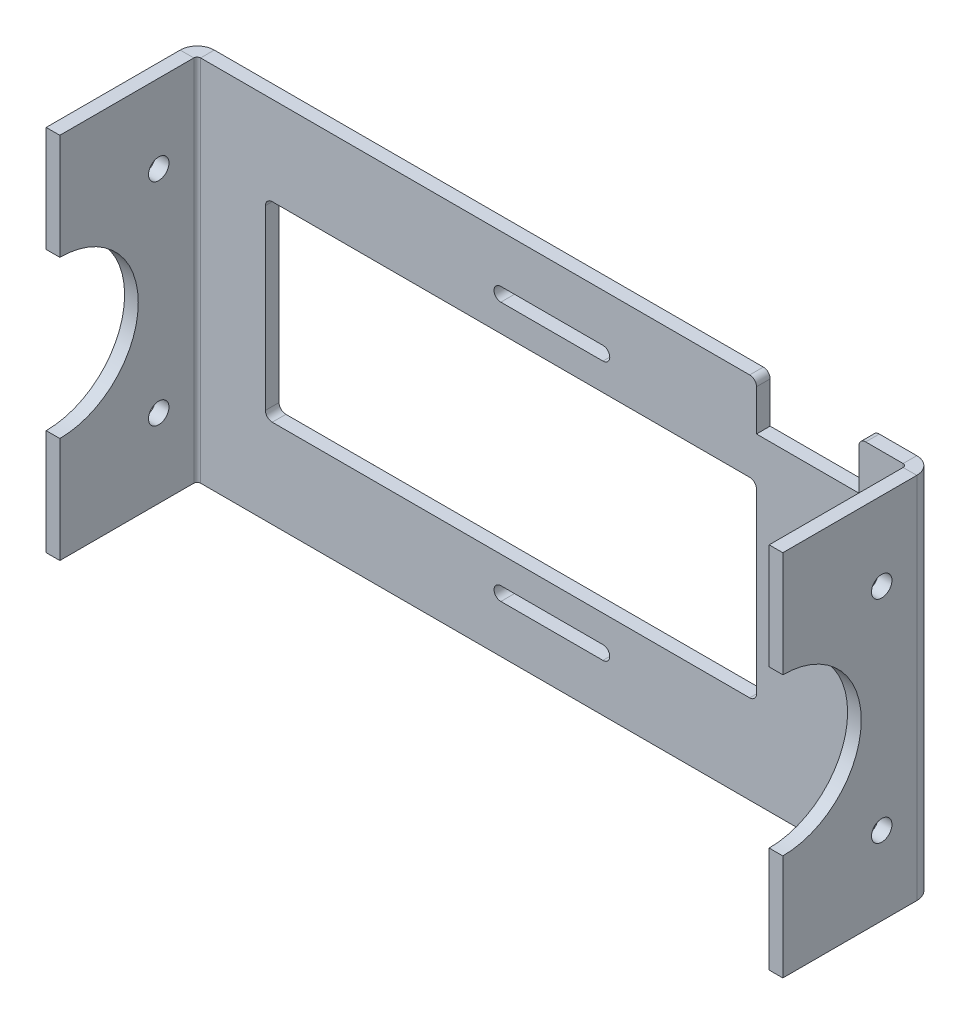
from build123d import *
from build123d.topology import SkipClean

# Parameters (mm, degrees)
DODANIE_WYCI_GNI_CIE1_DEPTH = 2
SZKIC_START                 = -28.065385
SZKIC_ZGI_CIA1_DEPTH        = 54
SZKIC_ZGI_CIA1_2_DEPTH      = 15.5
SZKIC_START_2               = 10.434615
SZKIC_ZGI_CIA1_3_DEPTH      = 15.5
SZKIC_START_3               = -56.031828
SZKIC_ZGI_CIA1_4_DEPTH      = 2.423909
SZKIC_START_4               = -12.565385
SZKIC_ZGI_CIA1_5_DEPTH      = 23
SZKIC_ZGI_CIA1_6_DEPTH      = 23
SZKIC_ZGI_CIA2_DEPTH        = 54
SZKIC_ZGI_CIA2_2_DEPTH      = 54
SZKIC_START_5               = 49.968172
SZKIC_ZGI_CIA2_3_DEPTH      = 2
SZKIC9_W                    = 72
SZKIC9_H                    = 28
SZKIC9_W_2                  = 15
SZKIC9_H_2                  = 7
WYTNIJ_WYCI_GNI_CIE1_DEPTH  = 66.825561
SZKIC10_R                   = 1.5
WYTNIJ_WYCI_GNI_CIE2_DEPTH  = 114.762973
ZAOKR_GLENIE2_R             = 1
ZAOKR_GLENIE3_R             = 1


with BuildPart() as part:
    # Szkic1 → Dodanie-wyciągnięcie1 (new body)
    with BuildSketch(Plane.XY):
        with BuildLine():
            Line((-75.531828, 25.934615), (71.468172, 25.934615))
            Line((71.468172, 25.934615), (71.468172, 10.434615))
            ThreePointArc((71.468172, 10.434615), (59.968172, -1.065385), (71.468172, -12.565385))
            Line((71.468172, -12.565385), (71.468172, -28.065385))
            Line((71.468172, -28.065385), (-75.531828, -28.065385))
            Line((-75.531828, -28.065385), (-75.531828, -12.565385))
            ThreePointArc((-75.531828, -12.565385), (-64.031828, -1.065385), (-75.531828, 10.434615))
            Line((-75.531828, 10.434615), (-75.531828, 25.934615))
        make_face()
    extrude(amount=DODANIE_WYCI_GNI_CIE1_DEPTH)

    # Szkic zgięcia1: read off the stored shape, not the designer's step
    # Szkic zgięcia1 outline → Szkic zgięcia1 (cut)
    with BuildSketch(Plane(origin=(0, 0, 0), x_dir=(1, 0, 0), z_dir=(0, 1, 0)).offset(SZKIC_START)):
        with BuildLine():
            Line((-75.531828, -2), (-55.981318, -2))
            ThreePointArc((-55.981318, -2), (-55.112967, -0.563508), (-53.531828, 0))
            Line((-53.531828, 0), (-75.531828, 0))
            Line((-75.531828, 0), (-75.531828, -2))
        make_face()
    extrude(amount=SZKIC_ZGI_CIA1_DEPTH, mode=Mode.SUBTRACT)

    # Szkic zgi_cia1 2 outline → Szkic zgi_cia1 2 (add)
    with BuildSketch(Plane(origin=(0, 0, 0), x_dir=(1, 0, 0), z_dir=(0, 1, 0)).offset(SZKIC_START)):
        with BuildLine():
            ThreePointArc((-55.981318, -2), (-56.019168, -2.248728), (-56.031828, -2.5))
            Line((-56.031828, -2.5), (-56.031828, -22.143806))
            Line((-56.031828, -22.143806), (-54.031828, -22.143806))
            Line((-54.031828, -22.143806), (-54.031828, -2.5))
            ThreePointArc((-54.031828, -2.5), (-53.885381, -2.146447), (-53.531828, -2))
            Line((-53.531828, -2), (-55.981318, -2))
        make_face()
    extrude(amount=SZKIC_ZGI_CIA1_2_DEPTH)

    # Szkic zgi_cia1 3 outline → Szkic zgi_cia1 3 (add)
    with BuildSketch(Plane(origin=(0, 0, 0), x_dir=(1, 0, 0), z_dir=(0, 1, 0)).offset(SZKIC_START_2)):
        with BuildLine():
            ThreePointArc((-55.981318, -2), (-56.019168, -2.248728), (-56.031828, -2.5))
            Line((-56.031828, -2.5), (-56.031828, -22.143806))
            Line((-56.031828, -22.143806), (-54.031828, -22.143806))
            Line((-54.031828, -22.143806), (-54.031828, -2.5))
            ThreePointArc((-54.031828, -2.5), (-53.885381, -2.146447), (-53.531828, -2))
            Line((-53.531828, -2), (-55.981318, -2))
        make_face()
    extrude(amount=SZKIC_ZGI_CIA1_3_DEPTH)

    # Szkic zgi_cia1 4 outline → Szkic zgi_cia1 4 (add)
    with BuildSketch(Plane.YZ.offset(SZKIC_START_3)):
        with BuildLine():
            Line((10.434615, 2), (10.434615, 22.143806))
            ThreePointArc((10.434615, 22.143806), (-1.065385, 10.643806), (-12.565385, 22.143806))
            Line((-12.565385, 22.143806), (-12.565385, 2))
            Line((-12.565385, 2), (10.434615, 2))
        make_face()
    extrude(amount=SZKIC_ZGI_CIA1_4_DEPTH)

    # Szkic zgi_cia1 5 outline → Szkic zgi_cia1 5 (cut)
    with SkipClean():  # the faces are left unmerged after this step: merging them gives an invalid solid
        with BuildSketch(Plane(origin=(0, 0, 0), x_dir=(1, 0, 0), z_dir=(0, 1, 0)).offset(SZKIC_START_4)):
            with BuildLine():
                ThreePointArc((-53.607919, -2.005824), (-53.911331, -2.174459), (-54.031828, -2.5))
                Line((-54.031828, -2.5), (-54.031828, -24))
                Line((-54.031828, -24), (-53.607919, -24))
                Line((-53.607919, -24), (-53.607919, -2.005824))
            make_face()
            with BuildLine():
                Line((-58, -24), (-56.031828, -24))
                Line((-56.031828, -24), (-56.031828, -2.5))
                ThreePointArc((-56.031828, -2.5), (-56.019168, -2.248728), (-55.981318, -2))
                Line((-55.981318, -2), (-58, -2))
                Line((-58, -2), (-58, -24))
            make_face()
        extrude(amount=SZKIC_ZGI_CIA1_5_DEPTH, mode=Mode.SUBTRACT)

    # Szkic zgi_cia1 6 outline → Szkic zgi_cia1 6 (add)
    with SkipClean():  # the faces are left unmerged after this step: merging them gives an invalid solid
        with BuildSketch(Plane(origin=(0, 0, 0), x_dir=(1, 0, 0), z_dir=(0, 1, 0)).offset(SZKIC_START_4)):
            with BuildLine():
                Line((-53.607919, -2), (-53.607919, -2.005824))
                ThreePointArc((-53.607919, -2.005824), (-53.569985, -2.001458), (-53.531828, -2))
                Line((-53.531828, -2), (-53.607919, -2))
            make_face()
        extrude(amount=SZKIC_ZGI_CIA1_6_DEPTH)

    # Szkic zgięcia2: read off the stored shape, not the designer's step
    # Szkic zgięcia2 outline → Szkic zgięcia2 (cut)
    with SkipClean():  # the faces are left unmerged after this step: merging them gives an invalid solid
        with BuildSketch(Plane(origin=(0, 0, 0), x_dir=(1, 0, 0), z_dir=(0, 1, 0)).offset(SZKIC_START)):
            with BuildLine():
                ThreePointArc((49.468172, 0), (51.049311, -0.563508), (51.917662, -2))
                Line((51.917662, -2), (71.468172, -2))
                Line((71.468172, -2), (71.468172, 0))
                Line((71.468172, 0), (49.468172, 0))
            make_face()
        extrude(amount=SZKIC_ZGI_CIA2_DEPTH, mode=Mode.SUBTRACT)

    # Szkic zgi_cia2 2 outline → Szkic zgi_cia2 2 (add)
    with SkipClean():  # the faces are left unmerged after this step: merging them gives an invalid solid
        with BuildSketch(Plane(origin=(0, 0, 0), x_dir=(1, 0, 0), z_dir=(0, 1, 0)).offset(SZKIC_START)):
            with BuildLine():
                Line((49.968172, -22.143806), (51.968172, -22.143806))
                Line((51.968172, -22.143806), (51.968172, -2.5))
                ThreePointArc((51.968172, -2.5), (51.955512, -2.248728), (51.917662, -2))
                Line((51.917662, -2), (49.468172, -2))
                ThreePointArc((49.468172, -2), (49.821725, -2.146447), (49.968172, -2.5))
                Line((49.968172, -2.5), (49.968172, -22.143806))
            make_face()
        extrude(amount=SZKIC_ZGI_CIA2_2_DEPTH)

    # Szkic zgi_cia2 3 outline → Szkic zgi_cia2 3 (cut)
    with SkipClean():  # the faces are left unmerged after this step: merging them gives an invalid solid
        with BuildSketch(Plane.YZ.offset(SZKIC_START_5)):
            with BuildLine():
                Line((10.434615, 22.143806), (-12.565385, 22.143806))
                ThreePointArc((-12.565385, 22.143806), (-1.065385, 10.643806), (10.434615, 22.143806))
            make_face()
        extrude(amount=SZKIC_ZGI_CIA2_3_DEPTH, mode=Mode.SUBTRACT)

    # Szkic9 → Wytnij-wyciągnięcie1 (cut, through all)
    with SkipClean():  # the faces are left unmerged after this step: merging them gives an invalid solid
        with BuildSketch(Plane.XY.offset(2)):
            with Locations((-8.031828, -1.065385)):
                Rectangle(SZKIC9_W, SZKIC9_H)
            with Locations((35.468172, 22.434615)):
                Rectangle(SZKIC9_W_2, SZKIC9_H_2)
            with BuildLine():
                Line((-9.515655, 18.934615), (5.451999, 18.934615))
                ThreePointArc((5.451999, 18.934615), (6.451999, 17.934615), (5.451999, 16.934615))
                Line((5.451999, 16.934615), (-9.515655, 16.934615))
                ThreePointArc((-9.515655, 16.934615), (-10.515655, 17.934615), (-9.515655, 18.934615))
            make_face()
            with BuildLine():
                Line((-9.515655, -19.065385), (5.451999, -19.065385))
                ThreePointArc((5.451999, -19.065385), (6.451999, -20.065385), (5.451999, -21.065385))
                Line((5.451999, -21.065385), (-9.515655, -21.065385))
                ThreePointArc((-9.515655, -21.065385), (-10.515655, -20.065385), (-9.515655, -19.065385))
            make_face()
        extrude(amount=-WYTNIJ_WYCI_GNI_CIE1_DEPTH, mode=Mode.SUBTRACT)

    # Szkic10 → Wytnij-wyciągnięcie2 (cut, through all)
    with SkipClean():  # the faces are left unmerged after this step: merging them gives an invalid solid
        with BuildSketch(Plane.ZY.offset(56.031828)):
            with Locations((7.643806, 14.434615)):
                Circle(SZKIC10_R)
            with Locations((7.643806, -16.565385)):
                Circle(SZKIC10_R)
        extrude(amount=-WYTNIJ_WYCI_GNI_CIE2_DEPTH, mode=Mode.SUBTRACT)

    # Zaokrąglenie2
    zaokr_glenie2_edges = [part.edges().sort_by_distance(p)[0] for p in [
        (27.968172, 25.934615, 1),
        (42.968172, 25.934615, 1),
    ]]
    fillet(zaokr_glenie2_edges, radius=ZAOKR_GLENIE2_R)

    # Zaokrąglenie3
    zaokr_glenie3_edges = [part.edges().sort_by_distance(p)[0] for p in [
        (-44.031828, -15.065385, 1),
        (-44.031828, 12.934615, 1),
        (27.968172, 12.934615, 1),
        (27.968172, -15.065385, 1),
    ]]
    fillet(zaokr_glenie3_edges, radius=ZAOKR_GLENIE3_R)


solid = part.part
